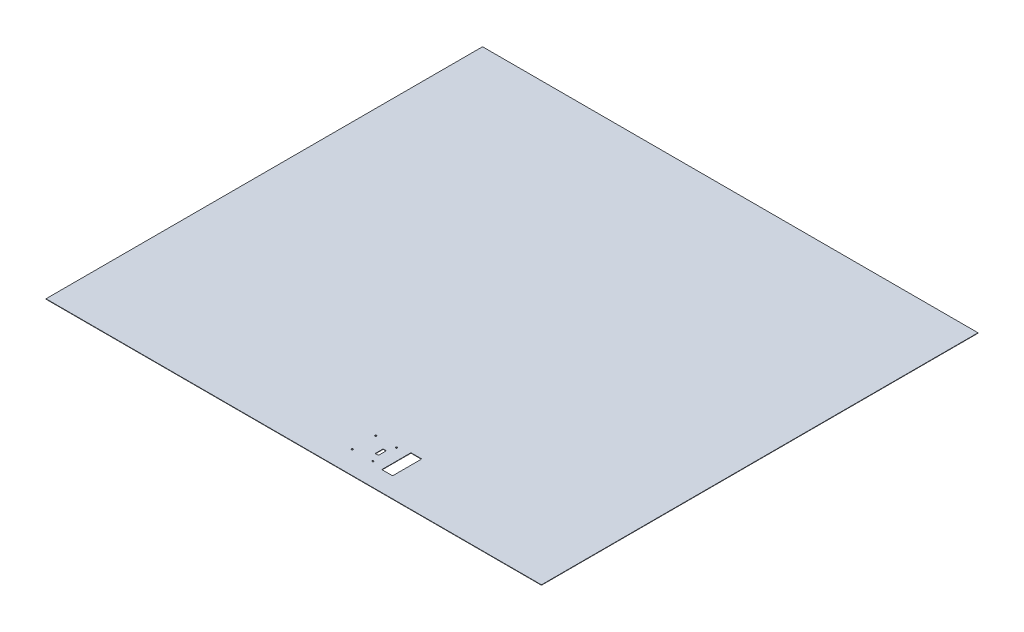
from build123d import *

# Parameters (mm, degrees)
SKETCH1_W           = 1240.5
SKETCH1_H           = 1093
BOSS_EXTRUDE1_DEPTH = 1
SKETCH2_W           = 27
SKETCH2_H           = 73
CUT_EXTRUDE1_DEPTH  = 1
SKETCH3_R           = 2
CUT_EXTRUDE2_DEPTH  = 1003.921690507
SKETCH4_W           = 8
SKETCH4_H           = 20
CUT_EXTRUDE3_DEPTH  = 1
FILLET1_R           = 2


with BuildPart() as part:
    # Sketch1 → Boss-Extrude1 (new body)
    with BuildSketch(Plane(origin=(0, 0, 0), x_dir=(1, 0, 0), z_dir=(0, 1, 0))):
        with Locations((-7.643523714, 235.549001129)):
            Rectangle(SKETCH1_W, SKETCH1_H)
    extrude(amount=BOSS_EXTRUDE1_DEPTH)

    # Sketch2 → Cut-Extrude1 (cut)
    with BuildSketch(Plane(origin=(0, 1, 0), x_dir=(1, 0, 0), z_dir=(0, 1, 0))):
        with Locations((176.356476286, -224.450998871)):
            Rectangle(SKETCH2_W, SKETCH2_H)
    extrude(amount=-CUT_EXTRUDE1_DEPTH, mode=Mode.SUBTRACT)

    # Sketch3 → Cut-Extrude2 (cut, through all)
    with BuildSketch(Plane(origin=(0, 1, 0), x_dir=(1, 0, 0), z_dir=(0, 1, 0))):
        with Locations((133.656476286, -194.950998871)):
            Circle(SKETCH3_R)
        with Locations((133.656476286, -253.950998871)):
            Circle(SKETCH3_R)
        with Locations((81.976476286, -194.950998871)):
            Circle(SKETCH3_R)
        with Locations((81.976476286, -253.950998871)):
            Circle(SKETCH3_R)
    extrude(amount=-CUT_EXTRUDE2_DEPTH, mode=Mode.SUBTRACT)

    # Sketch4 → Cut-Extrude3 (cut)
    with BuildSketch(Plane(origin=(0, 1, 0), x_dir=(1, 0, 0), z_dir=(0, 1, 0))):
        with Locations((123.756476286, -224.450998871)):
            Rectangle(SKETCH4_W, SKETCH4_H)
    extrude(amount=-CUT_EXTRUDE3_DEPTH, mode=Mode.SUBTRACT)

    # Fillet1
    fillet1_edges = [part.edges().sort_by_distance(p)[0] for p in [
        (119.756476286, 0.5, 214.450998871),
        (119.756476286, 0.5, 234.450998871),
        (127.756476286, 0.5, 234.450998871),
        (127.756476286, 0.5, 214.450998871),
    ]]
    fillet(fillet1_edges, radius=FILLET1_R)


solid = part.part
